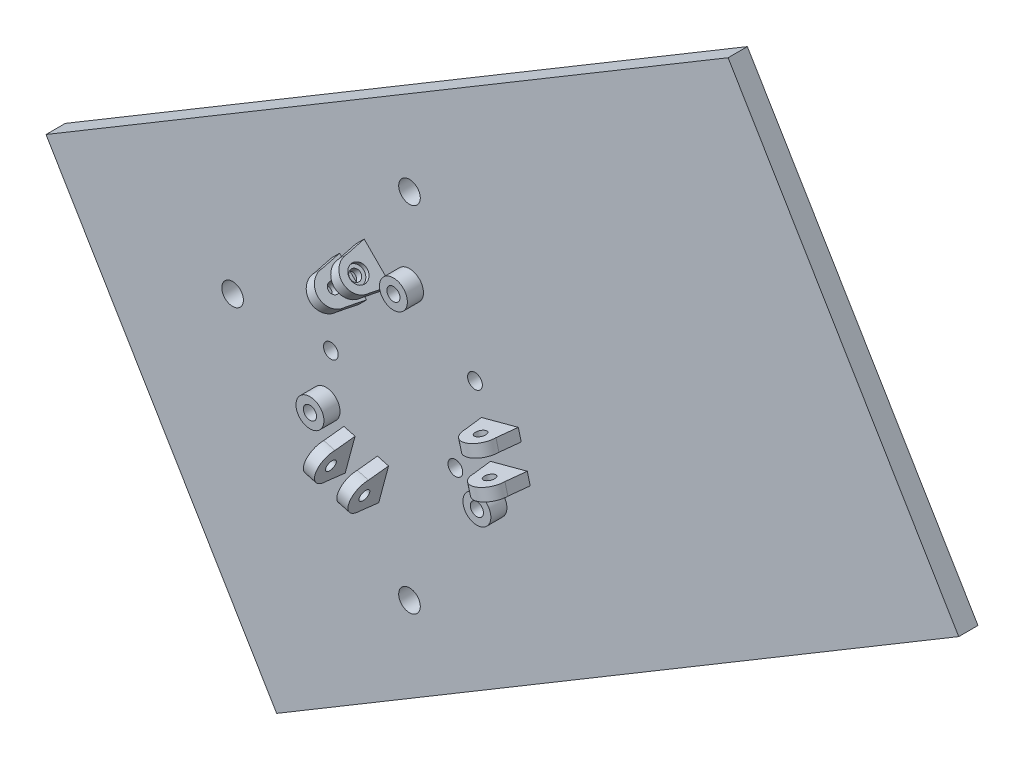
from build123d import *

# Parameters (mm, degrees)
F_01_START                                    = -12
S01_ROUNDED_V3_BACKPLATE_WITH_CAGE_AND_R      = 3.365102548
S01_ROUNDED_V3_BACKPLATE_WITH_CAGE_AND_R_2    = 2.294388101
F_01_ROUNDED_V3_BACKPLATE_WITH_CAGE_AND_DEPTH = 6
F_02_START                                    = -6
S02_THREE_CORD_GUIDE_PEDESTALS_R              = 4.35
F_02_THREE_CORD_GUIDE_PEDESTALS_DEPTH         = 5
F_03_START                                    = -13
S03_THREE_SMOOTH_GROMMET_SEATS_R              = 2.05
F_03_THREE_SMOOTH_GROMMET_SEATS_DEPTH         = 14
F_04_START                                    = -7.2
F_04_INTEGRAL_A1_FORK_CHEEK_L_DEPTH           = 3.6
F_05_START                                    = 3.6
F_05_INTEGRAL_A1_FORK_CHEEK_R_DEPTH           = 3.6
F_06_START                                    = -7.5
S06_A1_PIVOT_THROUGH_BOTH_CHEEKS_R            = 1.65
F_06_A1_PIVOT_THROUGH_BOTH_CHEEKS_DEPTH       = 15
F_07_START                                    = -7.3
S07_A1_RECESSED_PIVOT_SCREW_HEAD_R            = 2.7
F_07_A1_RECESSED_PIVOT_SCREW_HEAD_DEPTH       = 1.5
F_08_START                                    = -7.2
F_08_INTEGRAL_A2_FORK_CHEEK_L_DEPTH           = 3.6
F_09_START                                    = 3.6
F_09_INTEGRAL_A2_FORK_CHEEK_R_DEPTH           = 3.6
F_10_START                                    = -7.5
S10_A2_PIVOT_THROUGH_BOTH_CHEEKS_R            = 1.65
F_10_A2_PIVOT_THROUGH_BOTH_CHEEKS_DEPTH       = 15
F_11_START                                    = -7.3
S11_A2_RECESSED_PIVOT_SCREW_HEAD_R            = 2.7
F_11_A2_RECESSED_PIVOT_SCREW_HEAD_DEPTH       = 1.5
F_12_START                                    = -7.2
F_12_INTEGRAL_A3_FORK_CHEEK_L_DEPTH           = 3.6
F_13_START                                    = 3.6
F_13_INTEGRAL_A3_FORK_CHEEK_R_DEPTH           = 3.6
F_14_START                                    = -7.5
S14_A3_PIVOT_THROUGH_BOTH_CHEEKS_R            = 1.65
F_14_A3_PIVOT_THROUGH_BOTH_CHEEKS_DEPTH       = 15
F_15_START                                    = -7.3
S15_A3_RECESSED_PIVOT_SCREW_HEAD_R            = 2.7
F_15_A3_RECESSED_PIVOT_SCREW_HEAD_DEPTH       = 1.5


with BuildPart() as part:
    # S01 - Rounded V3 backplate with cage and cassette fixings → 01 - Rounded V3 backplate with cage and cassette fixings (new body)
    with BuildSketch(Plane.XY.offset(F_01_START)):
        Polygon((-113.163433478, 13.929728046), (41.356735424, 106.252625544), (99.189614728, 140.806684253), (170.996312782, 20.624330663), (113.163433478, -13.929728046), (-41.356735424, -106.252625544), align=None)
        with Locations((0, 55.065314422)):
            Circle(S01_ROUNDED_V3_BACKPLATE_WITH_CAGE_AND_R, mode=Mode.SUBTRACT)
        with Locations((-55.065314422, 0)):
            Circle(S01_ROUNDED_V3_BACKPLATE_WITH_CAGE_AND_R, mode=Mode.SUBTRACT)
        with Locations((0, -55.065314422)):
            Circle(S01_ROUNDED_V3_BACKPLATE_WITH_CAGE_AND_R, mode=Mode.SUBTRACT)
        with Locations((14.276192628, -12.236736538)):
            Circle(S01_ROUNDED_V3_BACKPLATE_WITH_CAGE_AND_R_2, mode=Mode.SUBTRACT)
        with Locations((20.394560897, 14.276192628)):
            Circle(S01_ROUNDED_V3_BACKPLATE_WITH_CAGE_AND_R_2, mode=Mode.SUBTRACT)
        with Locations((-24.473473076, 0)):
            Circle(S01_ROUNDED_V3_BACKPLATE_WITH_CAGE_AND_R_2, mode=Mode.SUBTRACT)
    extrude(amount=F_01_ROUNDED_V3_BACKPLATE_WITH_CAGE_AND_DEPTH)

    # S02 - Three cord guide pedestals → 02 - Three cord guide pedestals (add)
    with BuildSketch(Plane.XY.offset(F_02_START)):
        with Locations((25.980762114, -15)):
            Circle(S02_THREE_CORD_GUIDE_PEDESTALS_R)
        with Locations((0, 30)):
            Circle(S02_THREE_CORD_GUIDE_PEDESTALS_R)
        with Locations((-25.980762114, -15)):
            Circle(S02_THREE_CORD_GUIDE_PEDESTALS_R)
    extrude(amount=F_02_THREE_CORD_GUIDE_PEDESTALS_DEPTH)

    # S03 - Three smooth grommet seats → 03 - Three smooth grommet seats (cut)
    with BuildSketch(Plane.XY.offset(F_03_START)):
        with Locations((25.980762114, -15)):
            Circle(S03_THREE_SMOOTH_GROMMET_SEATS_R)
        with Locations((0, 30)):
            Circle(S03_THREE_SMOOTH_GROMMET_SEATS_R)
        with Locations((-25.980762114, -15)):
            Circle(S03_THREE_SMOOTH_GROMMET_SEATS_R)
    extrude(amount=F_03_THREE_SMOOTH_GROMMET_SEATS_DEPTH, mode=Mode.SUBTRACT)

    # S04 - Integral A1 fork cheek L → 04 - Integral A1 fork cheek L (add)
    with BuildSketch(Plane(origin=(2.009618943, -7.5, 0), x_dir=(0.9659258262890683, 0.25881904510252085, 0), z_dir=(-0.2588190451025208, 0.9659258262890682, 0)).offset(F_04_START)):
        with BuildLine():
            Line((35.077774789, 7), (22.877774789, 7))
            Line((22.877774789, 7), (24.027774789, 0))
            ThreePointArc((24.027774789, 0), (28.977774789, -4.95), (33.927774789, 0))
            Line((33.927774789, 0), (35.077774789, 7))
        make_face()
    extrude(amount=F_04_INTEGRAL_A1_FORK_CHEEK_L_DEPTH)

    # S05 - Integral A1 fork cheek R → 05 - Integral A1 fork cheek R (add)
    with BuildSketch(Plane(origin=(2.009618943, -7.5, 0), x_dir=(0.9659258262890683, 0.25881904510252085, 0), z_dir=(-0.2588190451025208, 0.9659258262890682, 0)).offset(F_05_START)):
        with BuildLine():
            Line((35.077774789, 7), (22.877774789, 7))
            Line((22.877774789, 7), (24.027774789, 0))
            ThreePointArc((24.027774789, 0), (28.977774789, -4.95), (33.927774789, 0))
            Line((33.927774789, 0), (35.077774789, 7))
        make_face()
    extrude(amount=F_05_INTEGRAL_A1_FORK_CHEEK_R_DEPTH)

    # S06 - A1 pivot through both cheeks → 06 - A1 pivot through both cheeks (cut)
    with BuildSketch(Plane(origin=(2.009618943, -7.5, 0), x_dir=(0.9659258262890683, 0.25881904510252085, 0), z_dir=(-0.2588190451025208, 0.9659258262890682, 0)).offset(F_06_START)):
        with Locations((28.977774789, 0)):
            Circle(S06_A1_PIVOT_THROUGH_BOTH_CHEEKS_R)
    extrude(amount=F_06_A1_PIVOT_THROUGH_BOTH_CHEEKS_DEPTH, mode=Mode.SUBTRACT)

    # S07 - A1 recessed pivot screw head → 07 - A1 recessed pivot screw head (cut)
    with BuildSketch(Plane(origin=(2.009618943, -7.5, 0), x_dir=(0.9659258262890683, 0.25881904510252085, 0), z_dir=(-0.2588190451025208, 0.9659258262890682, 0)).offset(F_07_START)):
        with Locations((28.977774789, 0)):
            Circle(S07_A1_RECESSED_PIVOT_SCREW_HEAD_R)
    extrude(amount=F_07_A1_RECESSED_PIVOT_SCREW_HEAD_DEPTH, mode=Mode.SUBTRACT)

    # S08 - Integral A2 fork cheek L → 08 - Integral A2 fork cheek L (add)
    with BuildSketch(Plane(origin=(5.490381057, 5.490381057, 0), x_dir=(-0.7071067811865475, 0.7071067811865477, 0), z_dir=(-0.7071067811865477, -0.7071067811865475, 0)).offset(F_08_START)):
        with BuildLine():
            Line((35.077774789, 7), (22.877774789, 7))
            Line((22.877774789, 7), (24.027774789, 0))
            ThreePointArc((24.027774789, 0), (28.977774789, -4.95), (33.927774789, 0))
            Line((33.927774789, 0), (35.077774789, 7))
        make_face()
    extrude(amount=F_08_INTEGRAL_A2_FORK_CHEEK_L_DEPTH)

    # S09 - Integral A2 fork cheek R → 09 - Integral A2 fork cheek R (add)
    with BuildSketch(Plane(origin=(5.490381057, 5.490381057, 0), x_dir=(-0.7071067811865475, 0.7071067811865477, 0), z_dir=(-0.7071067811865477, -0.7071067811865475, 0)).offset(F_09_START)):
        with BuildLine():
            Line((35.077774789, 7), (22.877774789, 7))
            Line((22.877774789, 7), (24.027774789, 0))
            ThreePointArc((24.027774789, 0), (28.977774789, -4.95), (33.927774789, 0))
            Line((33.927774789, 0), (35.077774789, 7))
        make_face()
    extrude(amount=F_09_INTEGRAL_A2_FORK_CHEEK_R_DEPTH)

    # S10 - A2 pivot through both cheeks → 10 - A2 pivot through both cheeks (cut)
    with BuildSketch(Plane(origin=(5.490381057, 5.490381057, 0), x_dir=(-0.7071067811865475, 0.7071067811865477, 0), z_dir=(-0.7071067811865477, -0.7071067811865475, 0)).offset(F_10_START)):
        with Locations((28.977774789, 0)):
            Circle(S10_A2_PIVOT_THROUGH_BOTH_CHEEKS_R)
    extrude(amount=F_10_A2_PIVOT_THROUGH_BOTH_CHEEKS_DEPTH, mode=Mode.SUBTRACT)

    # S11 - A2 recessed pivot screw head → 11 - A2 recessed pivot screw head (cut)
    with BuildSketch(Plane(origin=(5.490381057, 5.490381057, 0), x_dir=(-0.7071067811865475, 0.7071067811865477, 0), z_dir=(-0.7071067811865477, -0.7071067811865475, 0)).offset(F_11_START)):
        with Locations((28.977774789, 0)):
            Circle(S11_A2_RECESSED_PIVOT_SCREW_HEAD_R)
    extrude(amount=F_11_A2_RECESSED_PIVOT_SCREW_HEAD_DEPTH, mode=Mode.SUBTRACT)

    # S12 - Integral A3 fork cheek L → 12 - Integral A3 fork cheek L (add)
    with BuildSketch(Plane(origin=(-7.5, 2.009618943, 0), x_dir=(0, 0, -1), z_dir=(0.9659258262890683, -0.25881904510252113, 0)).offset(F_12_START)):
        with BuildLine():
            Line((7, -35.077774789), (7, -22.877774789))
            Line((7, -22.877774789), (0, -24.027774789))
            ThreePointArc((0, -24.027774789), (-4.95, -28.977774789), (0, -33.927774789))
            Line((0, -33.927774789), (7, -35.077774789))
        make_face()
    extrude(amount=F_12_INTEGRAL_A3_FORK_CHEEK_L_DEPTH)

    # S13 - Integral A3 fork cheek R → 13 - Integral A3 fork cheek R (add)
    with BuildSketch(Plane(origin=(-7.5, 2.009618943, 0), x_dir=(0, 0, -1), z_dir=(0.9659258262890683, -0.25881904510252113, 0)).offset(F_13_START)):
        with BuildLine():
            Line((7, -35.077774789), (7, -22.877774789))
            Line((7, -22.877774789), (0, -24.027774789))
            ThreePointArc((0, -24.027774789), (-4.95, -28.977774789), (0, -33.927774789))
            Line((0, -33.927774789), (7, -35.077774789))
        make_face()
    extrude(amount=F_13_INTEGRAL_A3_FORK_CHEEK_R_DEPTH)

    # S14 - A3 pivot through both cheeks → 14 - A3 pivot through both cheeks (cut)
    with BuildSketch(Plane(origin=(-7.5, 2.009618943, 0), x_dir=(0, 0, -1), z_dir=(0.9659258262890683, -0.25881904510252113, 0)).offset(F_14_START)):
        with Locations((0, -28.977774789)):
            Circle(S14_A3_PIVOT_THROUGH_BOTH_CHEEKS_R)
    extrude(amount=F_14_A3_PIVOT_THROUGH_BOTH_CHEEKS_DEPTH, mode=Mode.SUBTRACT)

    # S15 - A3 recessed pivot screw head → 15 - A3 recessed pivot screw head (cut)
    with BuildSketch(Plane(origin=(-7.5, 2.009618943, 0), x_dir=(0, 0, -1), z_dir=(0.9659258262890683, -0.25881904510252113, 0)).offset(F_15_START)):
        with Locations((0, -28.977774789)):
            Circle(S15_A3_RECESSED_PIVOT_SCREW_HEAD_R)
    extrude(amount=F_15_A3_RECESSED_PIVOT_SCREW_HEAD_DEPTH, mode=Mode.SUBTRACT)


solid = part.part
